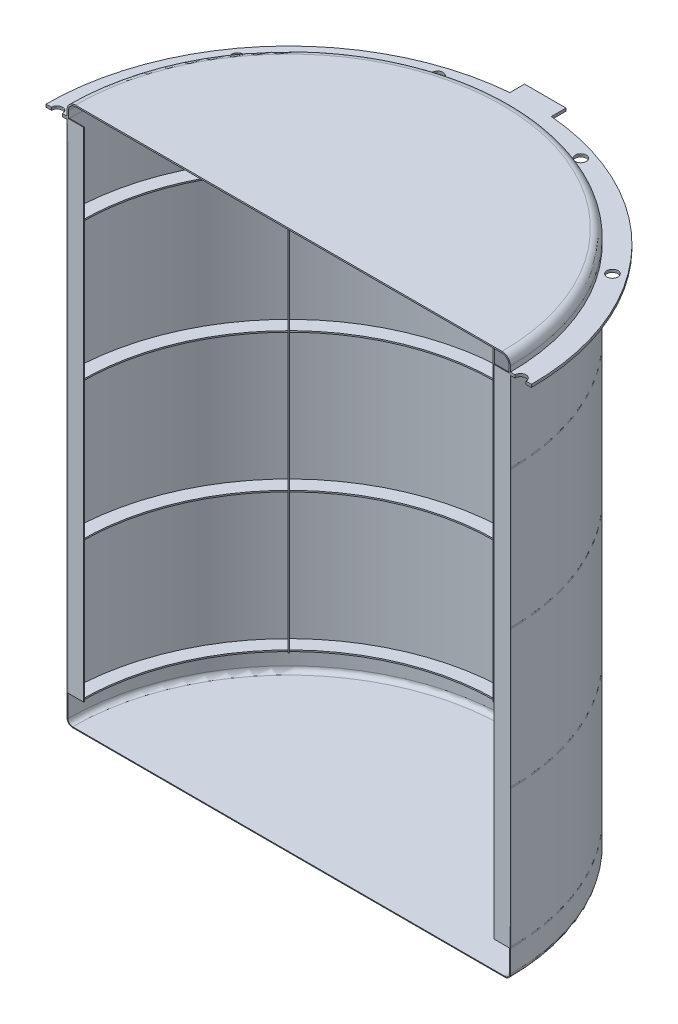
from build123d import *

# Parameters (mm, degrees)
REVOLVE1_ANGLE        = 180
BOSS_EXTRUDE1_START   = -5
BOSS_EXTRUDE1_DEPTH   = 5
SKETCH9_W             = 150
SKETCH9_H             = 100
BOSS_EXTRUDE2_DEPTH   = 5
SKETCH10_R            = 20
CUT_EXTRUDE1_DEPTH    = 5
CIRPATTERN2_COUNT     = 10
SWEEP1_START          = 99.999999944
SWEEP1_DEPTH          = 5
LPATTERN1_COUNT       = 4
LPATTERN1_PITCH       = 500
SKETCH12_W            = 2.5
SKETCH12_H            = 1800
BOSS_EXTRUDE4_DEPTH   = 60
CIRPATTERN1_START     = 99.999999919
CIRPATTERN1_OUTLINE_W = 60
CIRPATTERN1_OUTLINE_H = 5
CIRPATTERN1_DEPTH     = 1800.000000081
SKETCH13_R            = 20
BOSS_EXTRUDE5_DEPTH   = 5
REVOLVE2_ANGLE        = 180
SPLIT1_OUTLINE_W      = 60
SPLIT1_OUTLINE_H      = 1800
SPLIT1_DEPTH          = 2.5


# Read off the part's stored shape, not the designer's step: Sweep1, CirPattern1, Split1
with BuildPart() as part:
    # Sketch2 → Revolve1 (revolve)
    with BuildSketch(Plane.XY):
        with BuildLine():
            Line((0, 0), (781.5, 0))
            ThreePointArc((781.5, 0), (795.642135624, 5.857864376), (801.5, 20))
            Line((801.5, 20), (801.5, 1900))
            Line((801.5, 1900), (798.5, 1900))
            Line((798.5, 1900), (798.5, 20))
            ThreePointArc((798.5, 20), (793.52081528, 7.97918472), (781.5, 3))
            Line((781.5, 3), (0, 3))
            Line((0, 3), (0, 0))
        make_face()
    revolve(axis=Axis((0, 0, 0), (0, 1, 0)), revolution_arc=REVOLVE1_ANGLE)

    # Sketch8 → Boss-Extrude1 (add)
    with BuildSketch(Plane(origin=(0, 1900, 0), x_dir=(1, 0, 0), z_dir=(0, 1, 0)).offset(BOSS_EXTRUDE1_START)):
        with BuildLine():
            Line((798.5, 0), (877.7, 0))
            ThreePointArc((877.7, 0), (0, 877.7), (-877.7, 0))
            Line((-877.7, 0), (-798.5, 0))
            ThreePointArc((-798.5, 0), (0, 798.5), (798.5, 0))
        make_face()
    extrude(amount=BOSS_EXTRUDE1_DEPTH)

    # Sketch9 → Boss-Extrude2 (add)
    with BuildSketch(Plane(origin=(0, 1895, 0), x_dir=(-1, 0, 0), z_dir=(0, -1, 0))):
        with Locations((0, 877.7)):
            Rectangle(SKETCH9_W, SKETCH9_H)
    extrude(amount=-BOSS_EXTRUDE2_DEPTH)

    # Sketch10 → Cut-Extrude1 (cut)
    with BuildSketch(Plane(origin=(0, 1900, 0), x_dir=(-1, 0, 0), z_dir=(0, -1, 0))):
        with Locations(Location((-678.037142986, 492.622819946, 0), (0, 0, 270))):
            Circle(SKETCH10_R)
    cut_extrude1 = extrude(amount=CUT_EXTRUDE1_DEPTH, mode=Mode.SUBTRACT)

    # CirPattern2: Cut-Extrude1 ×10 about axis
    cirpattern2_axis = Axis((0, 0, 0), (0, 1, 0))
    for i in range(1, CIRPATTERN2_COUNT):
        add(cut_extrude1.rotate(cirpattern2_axis, i * 360 / CIRPATTERN2_COUNT), mode=Mode.SUBTRACT)


with BuildPart() as body_2:
    # Sweep1 outline → Sweep1 (new body)
    with BuildSketch(Plane(origin=(0, 0, 0), x_dir=(1.0, 1.0342338018629404e-11, 0), z_dir=(-1.0342338018629404e-11, 1.0, -4.49385954117553e-11)).offset(SWEEP1_START)):
        with BuildLine():
            Line((748.500000001, -5e-09), (801.500000001, -5e-09))
            add(Edge.make_bspline(
                [(801.500000001, -5e-09), (801.500000119, 0.655089321), (801.499199051, 1.309681481), (801.495987036, 2.621015829), (801.493575971, 3.277233172), (801.48391528, 5.247528637), (801.474238158, 6.563250197), (801.435398221, 10.516932065), (801.396426836, 13.161409565), (801.239489694, 21.120458199), (801.081500956, 26.460645531), (800.441133243, 42.580048914), (799.792352582, 53.458107395), (797.129931528, 86.458627587), (794.400059008, 108.948321641), (786.762270538, 154.745985518), (781.849790571, 178.059625529), (769.589543218, 225.225912469), (762.247715155, 249.062777759), (744.854605429, 297.061379632), (734.842302954, 321.121829605), (717.627102585, 357.19901881), (711.541466455, 369.181435339), (698.62524208, 393.076301052), (691.810586622, 404.959942583), (677.391950298, 428.64272829), (669.828331799, 440.37515371), (657.902559986, 457.83779694), (653.8331029, 463.631865515), (645.50521293, 475.158508428), (641.254557113, 480.880903386), (632.532585709, 492.297042714), (628.092367999, 497.949986968), (619.007950642, 509.198287974), (614.371518189, 514.783478271), (604.911290631, 525.867597905), (600.087495509, 531.36652724), (590.25362748, 542.269779298), (585.254510814, 547.662608597), (575.027259999, 558.391283539), (569.842971712, 563.681048938), (559.270345768, 574.171950651), (553.892953473, 579.361604952), (542.958958265, 589.620937906), (537.402355333, 594.690616557), (526.112886677, 604.701610174), (520.394396093, 609.630888202), (508.726599651, 619.400834786), (502.834855498, 624.193233608), (490.854366704, 633.657145627), (484.779986259, 638.316631051), (472.467829046, 647.482751594), (466.230052262, 651.989386712), (453.595977746, 660.841891688), (447.2174105, 665.176088813), (434.235708563, 673.72248796), (427.703602441, 677.887874102), (414.457253671, 686.066131893), (407.760731667, 690.067337286), (394.227689067, 697.887009881), (387.391168452, 701.705477082), (377.036410581, 707.290951321), (373.568161797, 709.129071592), (366.599175562, 712.757040463), (363.108774391, 714.541700353), (356.054975266, 718.082640209), (352.532956586, 719.818138916), (345.437714585, 723.249644983), (341.874823796, 724.940465511), (331.141885074, 729.937124155), (323.927570827, 733.167159524), (309.389127247, 739.419722639), (302.064997896, 742.442250387), (291.002613218, 746.816381547), (287.302453211, 748.247815143), (279.877764712, 751.05678988), (276.164667071, 752.430199924), (268.6694083, 755.138979354), (264.933016025, 756.457803336), (257.415296648, 759.04867245), (253.645398363, 760.316587217), (242.304333318, 764.037127212), (234.701796412, 766.406548326), (219.422377548, 770.920068571), (211.745495573, 773.06416771), (200.181394467, 776.108737146), (196.3185644, 777.094997033), (188.577808252, 779.009891735), (184.711898107, 779.935744082), (176.918081408, 781.740521317), (173.038292533, 782.608303891), (165.242086257, 784.29119166), (161.337684826, 785.103514372), (149.607427972, 787.452878149), (141.764520035, 788.90231505), (126.043055077, 791.56628867), (118.164498037, 792.780825393), (106.327292825, 794.425484087), (102.37832947, 794.944179203), (94.475173964, 795.922358085), (90.533003502, 796.38053583), (82.596574762, 797.24274121), (78.65046162, 797.641542819), (70.73151148, 798.382495085), (66.770698354, 798.723339476), (54.886069983, 799.657147328), (46.960065798, 800.161385651), (31.111952921, 800.934163648), (23.189844212, 801.202703324), (11.31690105, 801.429410812), (7.360956635, 801.475629591), (-0.546309311, 801.509477806), (-4.486175824, 801.497227964), (-12.405889828, 801.413767106), (-16.3398589, 801.343047787), (-24.22364231, 801.143274235), (-28.16199748, 801.014340757), (-39.964752822, 800.540950837), (-47.81684276, 800.109905077), (-63.479127347, 799.019841105), (-71.289322012, 798.360822899), (-86.858749847, 796.81774091), (-94.597190779, 795.936354111), (-110.097215285, 793.940748098), (-117.775435953, 792.837306855), (-133.105182033, 790.407722842), (-140.735903844, 789.084258508), (-155.921113616, 786.224625617), (-163.475601591, 784.688457069), (-178.500414254, 781.408050893), (-185.952779296, 779.668278726), (-200.837256759, 775.967433133), (-208.197370009, 774.02431554), (-222.854712624, 769.931801045), (-230.133969053, 767.786872906), (-244.587183958, 763.305592931), (-251.761142449, 760.969241104), (-265.997295289, 756.111026941), (-273.044754563, 753.594659782), (-287.080384681, 748.360342338), (-294.00949292, 745.664478079), (-307.773947738, 740.089061973), (-314.594545232, 737.215010517), (-328.107640177, 731.300942305), (-334.800137642, 728.260925555), (-348.052194315, 722.021643774), (-354.600316813, 718.828150318), (-367.604533799, 712.265541151), (-374.014797198, 708.919616558), (-386.717134383, 702.07092597), (-392.997757819, 698.573938428), (-411.623193698, 687.875647199), (-423.734907433, 680.477805073), (-447.422256397, 665.142570783), (-458.931085663, 657.248677627), (-481.365827674, 640.999601607), (-492.263832144, 632.664263461), (-524.080736572, 607.028528476), (-543.968896554, 589.226566846), (-571.986606031, 561.609772796), (-580.987852358, 552.285877184), (-598.380469883, 533.391284934), (-606.762411412, 523.829883447), (-630.979470498, 494.871653482), (-645.876441517, 475.214400637), (-673.307874424, 435.478599557), (-685.808310491, 415.455431378), (-702.894390614, 385.32522773), (-708.309940759, 375.26936822), (-718.600691801, 355.165957441), (-723.481364013, 345.106518483), (-732.699759456, 325.076692054), (-737.059999912, 315.05861592), (-745.272676928, 295.108592051), (-749.130545649, 285.164841595), (-756.372066231, 265.361481095), (-759.755718232, 255.501871109), (-764.492587747, 240.791758032), (-766.015109615, 235.901603812), (-768.95012756, 226.150426211), (-770.366088716, 221.277048297), (-773.076969058, 211.611537194), (-774.385839201, 206.769914144), (-776.892472326, 197.144445836), (-778.093693094, 192.348271965), (-781.54523904, 178.011741585), (-783.643447419, 168.523376795), (-787.456476413, 149.69760255), (-789.171297122, 140.360193133), (-791.472689562, 126.476516944), (-792.194680697, 121.869031076), (-793.551168246, 112.696407061), (-794.187596577, 108.116446374), (-795.368016037, 99.059697162), (-795.91977493, 94.523419418), (-796.937280622, 85.524726538), (-797.404958533, 81.047494935), (-798.688482984, 67.6832988), (-799.384819924, 58.863833301), (-801.001949831, 33.060888203), (-801.499931342, 16.340750123), (-801.499996268, -5e-09)],
                knots=[0.00042838, 0.00042838, 0.00042838, 0.00042838, 0.001404524, 0.001404524, 0.002380668, 0.002380668, 0.004332956, 0.004332956, 0.008237533, 0.008237533, 0.016046686, 0.016046686, 0.031664993, 0.031664993, 0.062901606, 0.062901606, 0.094138219, 0.094138219, 0.125374832, 0.125374832, 0.156611445, 0.156611445, 0.172229752, 0.172229752, 0.187848059, 0.187848059, 0.203466365, 0.203466365, 0.211275518, 0.211275518, 0.219084672, 0.219084672, 0.226893825, 0.226893825, 0.234702978, 0.234702978, 0.242512132, 0.242512132, 0.250321285, 0.250321285, 0.258130438, 0.258130438, 0.265939591, 0.265939591, 0.273748745, 0.273748745, 0.281557898, 0.281557898, 0.289367051, 0.289367051, 0.297176205, 0.297176205, 0.304985358, 0.304985358, 0.312794511, 0.312794511, 0.320603664, 0.320603664, 0.328412818, 0.328412818, 0.336221971, 0.336221971, 0.340126548, 0.340126548, 0.344031124, 0.344031124, 0.347935701, 0.347935701, 0.351840278, 0.351840278, 0.359649431, 0.359649431, 0.367458584, 0.367458584, 0.371363161, 0.371363161, 0.375267737, 0.375267737, 0.379172314, 0.379172314, 0.383076891, 0.383076891, 0.390886044, 0.390886044, 0.398695197, 0.398695197, 0.402599774, 0.402599774, 0.406504351, 0.406504351, 0.410408927, 0.410408927, 0.414313504, 0.414313504, 0.422122657, 0.422122657, 0.42993181, 0.42993181, 0.433836387, 0.433836387, 0.437740964, 0.437740964, 0.44164554, 0.44164554, 0.445550117, 0.445550117, 0.45335927, 0.45335927, 0.461168423, 0.461168423, 0.465073, 0.465073, 0.468977577, 0.468977577, 0.472882153, 0.472882153, 0.47678673, 0.47678673, 0.484595883, 0.484595883, 0.492405037, 0.492405037, 0.50021419, 0.50021419, 0.508023343, 0.508023343, 0.515832496, 0.515832496, 0.52364165, 0.52364165, 0.531450803, 0.531450803, 0.539259956, 0.539259956, 0.54706911, 0.54706911, 0.554878263, 0.554878263, 0.562687416, 0.562687416, 0.570496569, 0.570496569, 0.578305723, 0.578305723, 0.586114876, 0.586114876, 0.593924029, 0.593924029, 0.601733183, 0.601733183, 0.609542336, 0.609542336, 0.625160642, 0.625160642, 0.640778949, 0.640778949, 0.656397256, 0.656397256, 0.687633869, 0.687633869, 0.703252175, 0.703252175, 0.718870482, 0.718870482, 0.750107095, 0.750107095, 0.781343708, 0.781343708, 0.796962015, 0.796962015, 0.812580321, 0.812580321, 0.828198628, 0.828198628, 0.843816934, 0.843816934, 0.859435241, 0.859435241, 0.867244394, 0.867244394, 0.875053547, 0.875053547, 0.882862701, 0.882862701, 0.890671854, 0.890671854, 0.906290161, 0.906290161, 0.921908467, 0.921908467, 0.92971762, 0.92971762, 0.937526774, 0.937526774, 0.945335927, 0.945335927, 0.95314508, 0.95314508, 0.968763387, 0.968763387, 0.999326623, 0.999326623, 0.999326623, 0.999326623], degree=3))
            Line((-801.499996268, -5e-09), (-748.499996383, -5e-09))
            add(Edge.make_bspline(
                [(748.500000001, -5e-09), (748.5000001, 0.59949637), (748.499251955, 1.223173199), (748.496252114, 2.447885863), (748.494000318, 3.060754601), (748.484977817, 4.900891324), (748.475939999, 6.129689813), (748.439666198, 9.82215376), (748.40326987, 12.291887631), (748.256704422, 19.724937011), (748.109158902, 24.712099209), (747.511135618, 39.765604193), (746.905274247, 49.923947991), (744.419038395, 80.740665109), (741.869549803, 101.744003428), (734.736817839, 144.513250355), (730.149265803, 166.284687996), (718.69930006, 210.333747863), (711.843312281, 232.593249098), (695.600339569, 277.417894766), (686.250110744, 299.887323093), (670.173282951, 333.578871589), (664.490294846, 344.7684714), (652.427655065, 367.08421549), (646.063910277, 378.181555861), (632.598720896, 400.298293357), (625.535637866, 411.254286523), (614.397841375, 427.563114959), (610.597275388, 432.97433459), (602.819984369, 443.738892807), (598.850949468, 449.082166169), (590.705727266, 459.74340171), (586.559869147, 465.021580713), (578.076000919, 475.526283411), (573.745845505, 480.742526487), (564.910568281, 491.094420154), (560.405446721, 496.230070769), (551.22171385, 506.412488718), (546.553963, 511.447863424), (537.002999513, 521.467093861), (532.16254739, 526.406017418), (522.288824103, 536.203418849), (517.266594692, 541.050313901), (507.0547818, 550.632025483), (501.865198589, 555.366842026), (491.322062856, 564.716021136), (485.982789115, 569.318427722), (475.086537541, 578.442326684), (469.585695225, 582.9167515), (458.397149285, 591.755073225), (452.723906873, 596.106861382), (441.224835074, 604.667658358), (435.399005967, 608.876667187), (423.600119412, 617.143968587), (417.644705876, 621.190645635), (405.521432139, 629.171905475), (399.422839547, 633.060837861), (387.052089111, 640.698503748), (380.797739176, 644.435513738), (368.158300485, 651.738843466), (361.773212026, 655.305163193), (352.10294121, 660.521417324), (348.864077969, 662.237965245), (342.356375055, 665.62579567), (339.097838592, 667.291906069), (332.510479085, 670.598697687), (329.222521934, 672.218856533), (322.596951378, 675.423213136), (319.269703636, 677.002207435), (309.246214275, 681.66858596), (302.508225963, 684.685362622), (288.929694933, 690.525095176), (282.089152506, 693.348051044), (271.758011648, 697.43304415), (268.302576909, 698.769802542), (261.369363878, 701.392837872), (257.902998506, 702.674990197), (250.903371319, 705.204648841), (247.415310285, 706.435815639), (240.395240786, 708.855177195), (236.874679135, 710.039235085), (226.283258883, 713.513847257), (219.182664284, 715.726836844), (204.912041442, 719.942360071), (197.742013486, 721.944893667), (186.942307378, 724.788214981), (183.334961433, 725.709243047), (176.106617917, 727.49737801), (172.497636598, 728.361702364), (165.219193929, 730.047136876), (161.59725288, 730.857243039), (154.317128338, 732.428729492), (150.670960566, 733.187327356), (139.716081031, 735.381396717), (132.390992218, 736.735140848), (117.707514083, 739.223229489), (110.349125042, 740.357573933), (99.294362285, 741.893520244), (95.60657832, 742.377908085), (88.226585102, 743.291334818), (84.54641687, 743.719065588), (77.134792525, 744.524256763), (73.450883769, 744.896555524), (66.056121625, 745.5884611), (62.357272843, 745.906763742), (51.258241268, 746.778845099), (43.855572304, 747.249794205), (29.053859675, 747.97154814), (21.654816288, 748.222352879), (10.56668176, 748.434074866), (6.872375527, 748.477235453), (-0.511472641, 748.5088431), (-4.1895229, 748.497411267), (-11.585537787, 748.419469344), (-15.258193618, 748.353443903), (-22.620149955, 748.166893348), (-26.298027894, 748.0464886), (-37.320575813, 747.60439157), (-44.65416095, 747.201813602), (-59.282222161, 746.183729528), (-66.576697971, 745.568223316), (-81.116961172, 744.127141571), (-88.341855643, 743.304255836), (-102.816925316, 741.440611292), (-109.985806253, 740.410359024), (-124.302160413, 738.141385683), (-131.428930059, 736.905330003), (-145.611294802, 734.234549864), (-152.666889644, 732.799825289), (-166.698512536, 729.736264801), (-173.65646326, 728.111923426), (-187.556689563, 724.655800001), (-194.428752329, 722.841523525), (-208.117112702, 719.019561065), (-214.915554443, 717.016314535), (-228.414122562, 712.831026806), (-235.114248684, 710.648985494), (-248.409313629, 706.111925971), (-254.989393375, 703.762448967), (-268.096903224, 698.87425607), (-274.566735724, 696.357073137), (-287.421195494, 691.1502587), (-293.791197116, 688.466081334), (-306.411591072, 682.942707819), (-312.661983185, 680.103511556), (-325.037972063, 674.276696605), (-331.152011397, 671.294910185), (-343.296311352, 665.166260201), (-349.28187724, 662.0420073), (-361.144399646, 655.646117759), (-367.010026011, 652.380198676), (-384.404811913, 642.388782279), (-395.71500713, 635.480520396), (-417.83600613, 621.159344019), (-428.583318388, 613.787766108), (-449.535451151, 598.612517029), (-459.712387224, 590.828697692), (-489.425366592, 566.88815167), (-507.998401835, 550.2633628), (-534.163411871, 524.472757253), (-542.568439768, 515.766434156), (-558.810926776, 498.121294273), (-566.638929479, 489.191791393), (-589.25592359, 462.146884155), (-603.167207081, 443.790366659), (-628.78470868, 406.682135706), (-640.458614623, 387.98293895), (-656.414585279, 359.845610683), (-661.472014478, 350.454734), (-671.082373216, 331.680497927), (-675.640425407, 322.286000106), (-684.249245107, 303.580666254), (-688.321945761, 294.223277841), (-695.991326463, 275.593015412), (-699.593781657, 266.3075868), (-706.355951425, 247.815105262), (-709.515663703, 238.608051363), (-713.939272077, 224.870755209), (-715.361146343, 220.303873582), (-718.102234991, 211.196998351), (-719.424850162, 206.644879164), (-721.956470792, 197.618509781), (-723.179248357, 193.095376342), (-725.520296266, 184.105755076), (-726.642088578, 179.626709585), (-729.865279895, 166.238685504), (-731.824500485, 157.378811241), (-735.384988783, 139.799886714), (-736.986254898, 131.080835796), (-739.135424188, 118.115480566), (-739.809690805, 113.812567816), (-741.076584607, 105.245780367), (-741.671136666, 100.967136757), (-742.773499694, 92.509274268), (-743.288979603, 88.271312257), (-744.239273612, 79.867031083), (-744.676025786, 75.685841744), (-745.874627661, 63.205868714), (-746.524828026, 54.970673983), (-748.034835592, 30.876974302), (-748.499934863, 15.264102019), (-748.499996383, -5e-09)],
                knots=[0.00042838, 0.00042838, 0.00042838, 0.00042838, 0.001404524, 0.001404524, 0.002380668, 0.002380668, 0.004332956, 0.004332956, 0.008237533, 0.008237533, 0.016046686, 0.016046686, 0.031664993, 0.031664993, 0.062901606, 0.062901606, 0.094138219, 0.094138219, 0.125374832, 0.125374832, 0.156611445, 0.156611445, 0.172229752, 0.172229752, 0.187848059, 0.187848059, 0.203466365, 0.203466365, 0.211275518, 0.211275518, 0.219084672, 0.219084672, 0.226893825, 0.226893825, 0.234702978, 0.234702978, 0.242512132, 0.242512132, 0.250321285, 0.250321285, 0.258130438, 0.258130438, 0.265939591, 0.265939591, 0.273748745, 0.273748745, 0.281557898, 0.281557898, 0.289367051, 0.289367051, 0.297176205, 0.297176205, 0.304985358, 0.304985358, 0.312794511, 0.312794511, 0.320603664, 0.320603664, 0.328412818, 0.328412818, 0.336221971, 0.336221971, 0.340126548, 0.340126548, 0.344031124, 0.344031124, 0.347935701, 0.347935701, 0.351840278, 0.351840278, 0.359649431, 0.359649431, 0.367458584, 0.367458584, 0.371363161, 0.371363161, 0.375267737, 0.375267737, 0.379172314, 0.379172314, 0.383076891, 0.383076891, 0.390886044, 0.390886044, 0.398695197, 0.398695197, 0.402599774, 0.402599774, 0.406504351, 0.406504351, 0.410408927, 0.410408927, 0.414313504, 0.414313504, 0.422122657, 0.422122657, 0.42993181, 0.42993181, 0.433836387, 0.433836387, 0.437740964, 0.437740964, 0.44164554, 0.44164554, 0.445550117, 0.445550117, 0.45335927, 0.45335927, 0.461168423, 0.461168423, 0.465073, 0.465073, 0.468977577, 0.468977577, 0.472882153, 0.472882153, 0.47678673, 0.47678673, 0.484595883, 0.484595883, 0.492405037, 0.492405037, 0.50021419, 0.50021419, 0.508023343, 0.508023343, 0.515832496, 0.515832496, 0.52364165, 0.52364165, 0.531450803, 0.531450803, 0.539259956, 0.539259956, 0.54706911, 0.54706911, 0.554878263, 0.554878263, 0.562687416, 0.562687416, 0.570496569, 0.570496569, 0.578305723, 0.578305723, 0.586114876, 0.586114876, 0.593924029, 0.593924029, 0.601733183, 0.601733183, 0.609542336, 0.609542336, 0.625160642, 0.625160642, 0.640778949, 0.640778949, 0.656397256, 0.656397256, 0.687633869, 0.687633869, 0.703252175, 0.703252175, 0.718870482, 0.718870482, 0.750107095, 0.750107095, 0.781343708, 0.781343708, 0.796962015, 0.796962015, 0.812580321, 0.812580321, 0.828198628, 0.828198628, 0.843816934, 0.843816934, 0.859435241, 0.859435241, 0.867244394, 0.867244394, 0.875053547, 0.875053547, 0.882862701, 0.882862701, 0.890671854, 0.890671854, 0.906290161, 0.906290161, 0.921908467, 0.921908467, 0.92971762, 0.92971762, 0.937526774, 0.937526774, 0.945335927, 0.945335927, 0.95314508, 0.95314508, 0.968763387, 0.968763387, 0.999326485, 0.999326485, 0.999326485, 0.999326485], degree=3))
        make_face()
    sweep1 = extrude(amount=SWEEP1_DEPTH)


with BuildPart() as lpattern1_1:
    # LPattern1: Sweep1 ×4
    with Locations(*[(0, i * LPATTERN1_PITCH, 0) for i in range(1, LPATTERN1_COUNT)]):
        add(sweep1)


with BuildPart() as body_6:
    # Sketch12 → Boss-Extrude4 (new body)
    with BuildSketch(Plane.XY.offset(-801.5)):
        with Locations((-1.25, 1000)):
            Rectangle(SKETCH12_W, SKETCH12_H)
        with Locations((1.25, 1000)):
            Rectangle(SKETCH12_W, SKETCH12_H)
    extrude(amount=BOSS_EXTRUDE4_DEPTH)


with BuildPart() as body_7:
    # CirPattern1 outline → CirPattern1 (new body)
    with BuildSketch(Plane(origin=(0, 0, 0), x_dir=(1, 0, 0), z_dir=(0, 1, 0)).offset(CIRPATTERN1_START)):
        Polygon((-522.551911297, 526.087445203), (-564.978318168, 568.513852074), (-568.513852074, 564.978318168), (-526.087445203, 522.551911297), align=None)
        Polygon((526.087445203, 522.551911297), (568.513852074, 564.978318168), (564.978318168, 568.513852074), (522.551911297, 526.087445203), align=None)
        with Locations((771.5, 0)):
            Rectangle(CIRPATTERN1_OUTLINE_W, CIRPATTERN1_OUTLINE_H)
        with Locations((-771.5, 0)):
            Rectangle(CIRPATTERN1_OUTLINE_W, CIRPATTERN1_OUTLINE_H)
    extrude(amount=CIRPATTERN1_DEPTH)

    # Split1 outline → Split1 (cut)
    with BuildSketch(Plane.XY):
        with Locations((771.5, 1000)):
            Rectangle(SPLIT1_OUTLINE_W, SPLIT1_OUTLINE_H)
        with Locations((-771.5, 1000)):
            Rectangle(SPLIT1_OUTLINE_W, SPLIT1_OUTLINE_H)
    extrude(amount=SPLIT1_DEPTH, mode=Mode.SUBTRACT)


with BuildPart() as body_8:
    # Sketch13 → Boss-Extrude5 (new body)
    with BuildSketch(Plane(origin=(0, 1900, 0), x_dir=(1, 0, 0), z_dir=(0, 1, 0))):
        with BuildLine():
            ThreePointArc((-858.1, 0), (-838.1, 20), (-818.1, 0))
            Line((-818.1, 0), (-798.5, 0))
            ThreePointArc((-798.5, 0), (0, 798.5), (798.5, 0))
            Line((798.5, 0), (818.1, 0))
            ThreePointArc((818.1, 0), (838.1, 20), (858.1, 0))
            Line((858.1, 0), (877.7, 0))
            ThreePointArc((877.7, 0), (646.600645685, 593.5190772), (75, 874.489731215))
            Line((75, 874.489731215), (75, 927.7))
            Line((75, 927.7), (-75, 927.7))
            Line((-75, 927.7), (-75, 874.489731215))
            ThreePointArc((-75, 874.489731215), (-646.600645685, 593.5190772), (-877.7, 0))
            Line((-877.7, 0), (-858.1, 0))
        make_face()
        with Locations((-678.037142986, 492.622819946)):
            Circle(SKETCH13_R, mode=Mode.SUBTRACT)
        with Locations((-258.987142986, 797.080466307)):
            Circle(SKETCH13_R, mode=Mode.SUBTRACT)
        with Locations((678.037142986, 492.622819946)):
            Circle(SKETCH13_R, mode=Mode.SUBTRACT)
        with Locations((258.987142986, 797.080466307)):
            Circle(SKETCH13_R, mode=Mode.SUBTRACT)
    extrude(amount=BOSS_EXTRUDE5_DEPTH)

    # Sketch14 → Revolve2 (revolve)
    with BuildSketch(Plane.XY):
        with BuildLine():
            Line((801.5, 1905), (801.5, 1925))
            ThreePointArc((801.5, 1925), (792.713203436, 1946.213203436), (771.5, 1955))
            Line((771.5, 1955), (0, 1955))
            Line((0, 1955), (0, 1950))
            Line((0, 1950), (771.5, 1950))
            ThreePointArc((771.5, 1950), (789.17766953, 1942.67766953), (796.5, 1925))
            Line((796.5, 1925), (796.5, 1905))
            Line((796.5, 1905), (796.5, 1900))
            Line((796.5, 1900), (801.5, 1900))
            Line((801.5, 1900), (801.5, 1905))
        make_face()
    revolve(axis=Axis((0, 1900, 0), (0, 1, 0)), revolution_arc=REVOLVE2_ANGLE)


solid = Compound([part.part, body_2.part, lpattern1_1.part, body_6.part, body_7.part, body_8.part])
